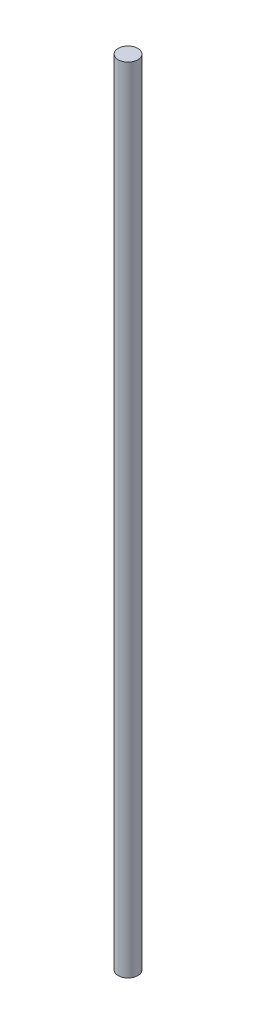
from build123d import *

# Parameters (mm, degrees)
SKETCH1_R           = 5.08
BOSS_EXTRUDE1_DEPTH = 408.94


with BuildPart() as part:
    # Sketch1 → Boss-Extrude1 (new body)
    with BuildSketch(Plane(origin=(0, 0, 0), x_dir=(1, 0, 0), z_dir=(0, 1, 0))):
        Circle(SKETCH1_R)
    extrude(amount=BOSS_EXTRUDE1_DEPTH)


solid = part.part
